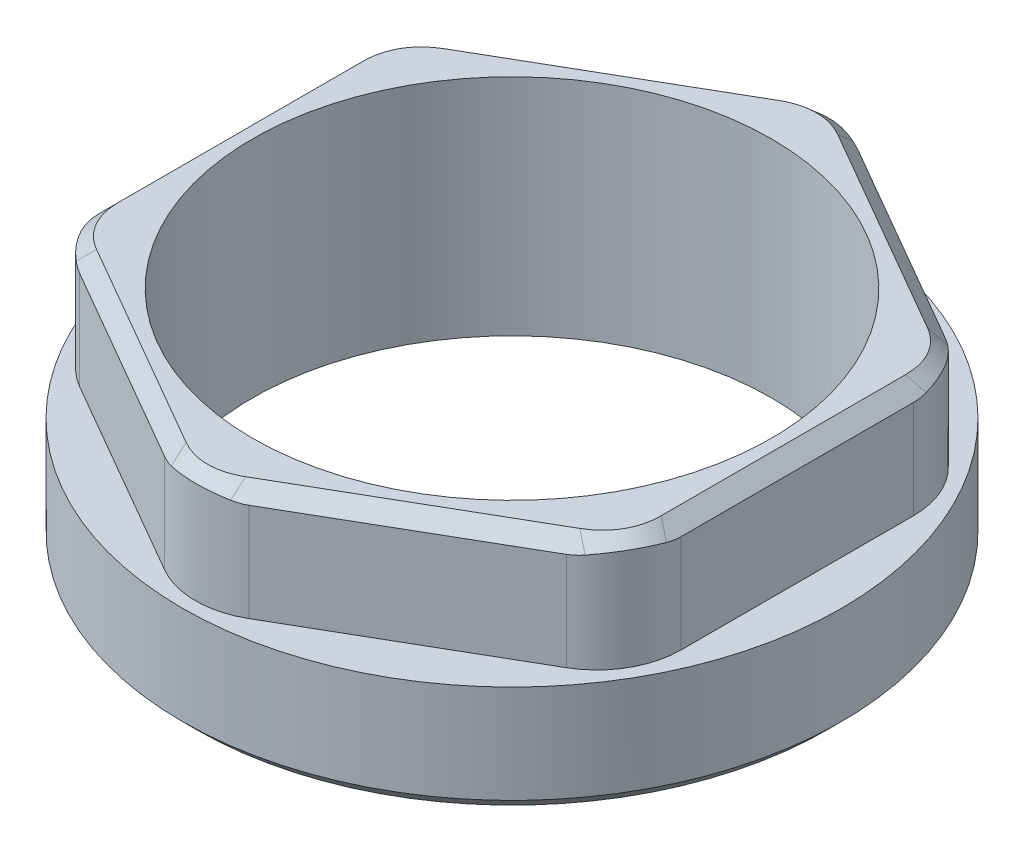
from build123d import *

# Parameters (mm, degrees)
SKETCH_1_R      = 11.75
SKETCH_1_R_2    = 9.25
EXTRUDE_1_DEPTH = 4
SKETCH_2_R      = 9.25
EXTRUDE_2_DEPTH = 4
CHAMFER_1_SIZE  = 0.5
FILLET_1_R      = 3


with BuildPart() as part:
    # 草图1 → 凸台-拉伸1 (new body)
    with BuildSketch(Plane(origin=(0, 0, 0), x_dir=(1, 0, 0), z_dir=(0, 1, 0))):
        with Locations(Location((0, 0, 0), (0, 0, 270))):
            Circle(SKETCH_1_R)
        with Locations(Location((0, 0, 0), (0, 0, 270))):
            Circle(SKETCH_1_R_2, mode=Mode.SUBTRACT)
    extrude(amount=EXTRUDE_1_DEPTH)

    # 草图2 → 凸台-拉伸2 (add)
    with BuildSketch(Plane(origin=(0, 4, 0), x_dir=(1, 0, 0), z_dir=(0, 1, 0))):
        Polygon((0, 11.75), (-10.175798494, 5.875), (-10.175798494, -5.875), (0, -11.75), (10.175798494, -5.875), (10.175798494, 5.875), align=None)
        with Locations(Location((0, 0, 0), (0, 0, 270))):
            Circle(SKETCH_2_R, mode=Mode.SUBTRACT)
    extrude(amount=EXTRUDE_2_DEPTH)

    # 倒角1
    chamfer_1_edges = [part.edges().sort_by_distance(p)[0] for p in [
        (5.087899247, 8, -8.8125),
        (-5.087899247, 8, -8.8125),
        (-10.175798494, 8, 0),
        (-5.087899247, 8, 8.8125),
        (5.087899247, 8, 8.8125),
        (10.175798494, 8, 0),
        (0, 0, -11.75),
    ]]
    chamfer(chamfer_1_edges, length=CHAMFER_1_SIZE)

    # 圆角1
    # the kernel refuses this fillet: 3 mm, written as the material it takes off along each edge
    with BuildSketch(Plane(origin=(-10.175798494, 4, 5.875), x_dir=(0.8660254037844421, 0, 0.49999999999999395), z_dir=(0, 1, 0)), Plane(origin=(-10.175798494, 4, -5.875), x_dir=(0, 0, 1), z_dir=(0, 1, 0)), Plane(origin=(0, 4, -11.75), x_dir=(-0.866025403784437, 0, 0.5000000000000027), z_dir=(0, 1, 0))) as fillet_1_piece_1:
        with BuildLine():
            CenterArc((FILLET_1_R * 0.57735026919, FILLET_1_R), FILLET_1_R, 210, 60)
            Line((-FILLET_1_R * 0.288675134595, FILLET_1_R * 0.5), (0, 0))
            Line((0, 0), (FILLET_1_R * 0.57735026919, 0))
        make_face()
    extrude(amount=7.830127019, mode=Mode.SUBTRACT)
    with BuildSketch(Plane(origin=(10.175798494, 4, -5.875), x_dir=(0, 0, 1), z_dir=(0, 1, 0)), Plane(origin=(10.175798494, 4, 5.875), x_dir=(-0.8660254037844379, 0, 0.5000000000000011), z_dir=(0, 1, 0)), Plane(origin=(0, 4, 11.75), x_dir=(-0.8660254037844418, 0, -0.4999999999999945), z_dir=(0, 1, 0))) as fillet_1_piece_2:
        with BuildLine():
            CenterArc((FILLET_1_R * 0.57735026919, -FILLET_1_R), FILLET_1_R, 90, 60)
            Line((-FILLET_1_R * 0.288675134595, -FILLET_1_R * 0.5), (0, 0))
            Line((0, 0), (FILLET_1_R * 0.57735026919, 0))
        make_face()
    extrude(amount=7.830127019, mode=Mode.SUBTRACT)
    with BuildSketch(Plane(origin=(7.820029772, 9.855768722, -4.514896294), x_dir=(0.2672612419124255, -0.2672612419124255, 0.9258200997725509), z_dir=(0.6546536707079768, -0.6546536707079768, -0.3779644730092288)), Plane(origin=(0, 9.855768722, 9.029792588), x_dir=(-0.935414346693487, -0.26726124191242306, -0.2314550249431329), z_dir=(3.5248488275713354e-15, -0.6546536707079781, 0.7559289460184537))) as fillet_1_piece_3:
        with BuildLine():
            CenterArc((FILLET_1_R * 0.377964473009, FILLET_1_R), FILLET_1_R, 228.590377891, 41.409622109)
            Line((-FILLET_1_R * 0.283473354757, FILLET_1_R * 0.25), (0, 0))
            Line((0, 0), (FILLET_1_R * 0.377964473009, 0))
        make_face()
    extrude(amount=6.433229711, mode=Mode.SUBTRACT)
    with BuildSketch(Plane(origin=(12.031567217, 5.644231278, 6.946428571), x_dir=(-0.66815310478106, -0.2672612419124238, 0.6943650748294146), z_dir=(-0.6546536707079774, 0.6546536707079774, -0.37796447300922653)), Plane(origin=(0, 9.855768722, -9.029792588), x_dir=(-0.935414346693485, -0.26726124191242234, 0.2314550249431414), z_dir=(-3.944473687996493e-15, -0.6546536707079779, -0.755928946018454)), Plane(origin=(-7.820029772, 9.855768722, -4.514896294), x_dir=(-0.26726124191242423, -0.26726124191242345, 0.9258200997725519), z_dir=(-0.6546536707079775, -0.6546536707079774, -0.37796447300922653)), Plane(origin=(-7.820029772, 9.855768722, 4.514896294), x_dir=(0.6681531047810633, -0.26726124191242634, 0.6943650748294108), z_dir=(-0.6546536707079768, -0.6546536707079768, 0.37796447300922886))) as fillet_1_piece_4:
        with BuildLine():
            CenterArc((FILLET_1_R * 0.377964473009, -FILLET_1_R), FILLET_1_R, 90, 41.409622109)
            Line((-FILLET_1_R * 0.283473354757, -FILLET_1_R * 0.25), (0, 0))
            Line((0, 0), (FILLET_1_R * 0.377964473009, 0))
        make_face()
    extrude(amount=6.433229711, mode=Mode.SUBTRACT)


solid = part.part
